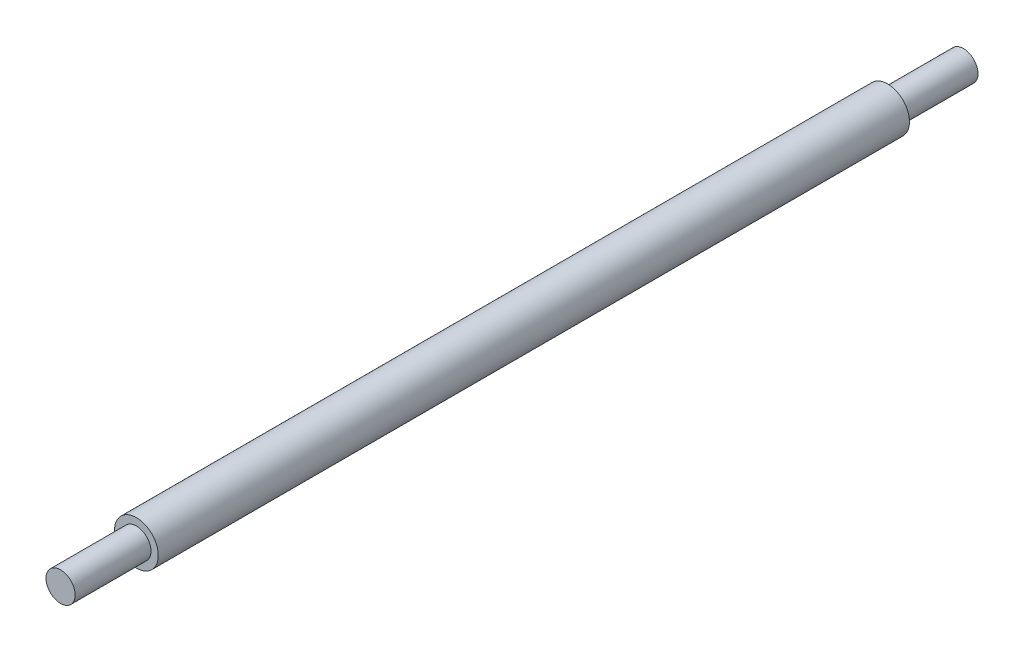
from build123d import *

# Parameters (mm, degrees)
SKETCH1_R           = 9.525
BOSS_EXTRUDE1_DEPTH = 327.025
SKETCH2_R           = 6.35
BOSS_EXTRUDE2_DEPTH = 33.02
BOSS_EXTRUDE3_START = 33.02
SKETCH3_R           = 6.35
BOSS_EXTRUDE3_DEPTH = 33.02


with BuildPart() as part:
    # Sketch1 → Boss-Extrude1 (new body)
    with BuildSketch(Plane.XY):
        Circle(SKETCH1_R)
    extrude(amount=BOSS_EXTRUDE1_DEPTH)

    # Sketch2 → Boss-Extrude2 (add)
    with BuildSketch(Plane.XY.offset(327.025)):
        Circle(SKETCH2_R)
    extrude(amount=BOSS_EXTRUDE2_DEPTH)

    # Sketch3 → Boss-Extrude3 (add)
    with BuildSketch(Plane(origin=(0, 0, 0), x_dir=(-1, 0, 0), z_dir=(0, 0, -1)).offset(BOSS_EXTRUDE3_START)):
        Circle(SKETCH3_R)
    extrude(amount=-BOSS_EXTRUDE3_DEPTH)


solid = part.part
